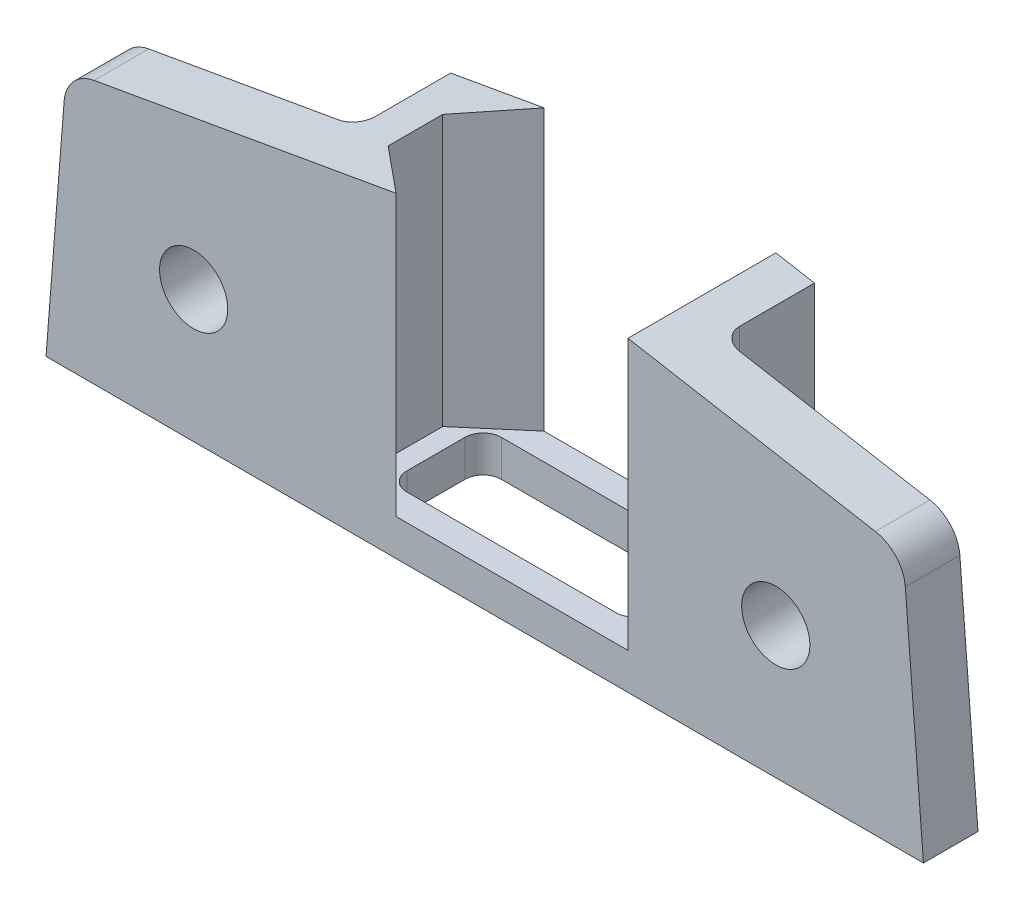
from build123d import *

# Parameters (mm, degrees)
SKETCH1_R           = 1.5
BOSS_EXTRUDE1_DEPTH = 8.13
CUT_EXTRUDE1_DEPTH  = 16.25
CUT_EXTRUDE2_REACH  = 32.018
SKETCH3_W           = 13.5
SKETCH3_H           = 5.2
SKETCH4_R           = 1.5
CUT_EXTRUDE3_DEPTH  = 5.13
CUT_EXTRUDE4_REACH  = 96.714
SKETCH5_W           = 48.91393719
SKETCH5_H           = 4.31806182
FILLET1_R           = 1
CUT_EXTRUDE6_REACH  = 96.417
SKETCH8_R           = 1.875


with BuildPart() as part:
    # Sketch1 → Boss-Extrude1 (new body)
    with BuildSketch(Plane.XY):
        with BuildLine():
            Line((-24.456968595, 69.43193818), (24.456968595, 69.43193818))
            Line((24.456968595, 69.43193818), (23.121499045, 86.400687699))
            ThreePointArc((23.121499045, 86.400687699), (22.608100633, 87.588503122), (21.474960733, 88.213385013))
            Line((21.474960733, 88.213385013), (0, 92))
            Line((0, 92), (-21.474960733, 88.213385013))
            ThreePointArc((-21.474960733, 88.213385013), (-22.608100633, 87.588503122), (-23.121499045, 86.400687699))
            Line((-23.121499045, 86.400687699), (-24.456968595, 69.43193818))
        make_face()
        with Locations((-16, 81)):
            Circle(SKETCH1_R, mode=Mode.SUBTRACT)
        with Locations((16, 81)):
            Circle(SKETCH1_R, mode=Mode.SUBTRACT)
    extrude(amount=BOSS_EXTRUDE1_DEPTH)

    # Sketch2 → Cut-Extrude1 (cut)
    with BuildSketch(Plane(origin=(0, 92, 0), x_dir=(1, 0, 0), z_dir=(0, 1, 0))):
        Polygon((7.875, 0), (-4.875, 0), (-7.875, -2.565), (-7.875, -5.565), (-4.875, -8.13), (7.875, -8.13), align=None)
    extrude(amount=-CUT_EXTRUDE1_DEPTH, mode=Mode.SUBTRACT)

    # Sketch3 → Cut-Extrude2 (cut, up to next)
    with BuildSketch(Plane(origin=(0, 75.75, 0), x_dir=(1, 0, 0), z_dir=(0, 1, 0)), mode=Mode.PRIVATE) as cut_extrude2_sk1:
        with Locations((0, -4.065)):
            Rectangle(SKETCH3_W, SKETCH3_H)
    cut_extrude2_tool1 = extrude(cut_extrude2_sk1.sketch, amount=-CUT_EXTRUDE2_REACH, mode=Mode.PRIVATE) & part.part
    add(cut_extrude2_tool1.solids().sort_by_distance((0, 75.75, 4.065))[0], mode=Mode.SUBTRACT)

    # Sketch4 → Cut-Extrude3 (cut)
    # profile 1 of 2: a face of its own
    with BuildSketch(Plane(origin=(0, 0, 0), x_dir=(-1, 0, 0), z_dir=(0, 0, -1))):
        with BuildLine():
            Line((-10, 69.43193818), (-10, 90.236730193))
            Line((-10, 90.236730193), (-21.474960733, 88.213385013))
            ThreePointArc((-21.474960733, 88.213385013), (-22.608100633, 87.588503122), (-23.121499045, 86.400687699))
            Line((-23.121499045, 86.400687699), (-24.456968595, 69.43193818))
            Line((-24.456968595, 69.43193818), (-10, 69.43193818))
        make_face()
        with Locations(Location((-16, 81, 0), (0, 0, 180))):
            Circle(SKETCH4_R, mode=Mode.SUBTRACT)
    # profile 2 of 2: a face of its own
    with BuildSketch(Plane(origin=(0, 0, 0), x_dir=(-1, 0, 0), z_dir=(0, 0, -1))):
        with BuildLine():
            Line((10, 90.236730193), (10, 69.43193818))
            Line((10, 69.43193818), (24.456968595, 69.43193818))
            Line((24.456968595, 69.43193818), (23.121499045, 86.400687699))
            ThreePointArc((23.121499045, 86.400687699), (22.608100633, 87.588503122), (21.474960733, 88.213385013))
            Line((21.474960733, 88.213385013), (10, 90.236730193))
        make_face()
        with Locations(Location((16, 81, 0), (0, 0, 180))):
            Circle(SKETCH4_R, mode=Mode.SUBTRACT)
    extrude(amount=-CUT_EXTRUDE3_DEPTH, mode=Mode.SUBTRACT)

    # Sketch5 → Cut-Extrude4 (cut, up to next)
    with BuildSketch(Plane(origin=(0, 0, 0), x_dir=(-1, 0, 0), z_dir=(0, 0, -1)), mode=Mode.PRIVATE) as cut_extrude4_sk1:
        with Locations((0, 71.59096909)):
            Rectangle(SKETCH5_W, SKETCH5_H)
    cut_extrude4_tool1 = extrude(cut_extrude4_sk1.sketch, amount=-CUT_EXTRUDE4_REACH, mode=Mode.PRIVATE) & part.part
    add(cut_extrude4_tool1.solids().sort_by_distance((0, 71.590969, 0))[0], mode=Mode.SUBTRACT)

    # Fillet1
    # the kernel refuses this fillet: 1 mm, written as the material it adds along each edge
    with BuildSketch(Plane(origin=(-10, 92.736730193, 5.13), x_dir=(-1, 0, 0), z_dir=(0, -1, 0))) as fillet1_piece_1_section:
        with BuildLine():
            CenterArc((FILLET1_R, FILLET1_R), FILLET1_R, 180, 90)
            Line((0, FILLET1_R), (0, 0))
            Line((0, 0), (FILLET1_R, 0))
        make_face()
    fillet1_piece_1 = extrude(amount=18.986730193, mode=Mode.PRIVATE)
    fillet1_piece_1 = split(fillet1_piece_1, bisect_by=Plane(origin=(-11.632189481, 89.94893115, 4.903310521), z_dir=(0.17364817766693327, -0.9848077530122076, 0)), keep=Keep.TOP, mode=Mode.PRIVATE)
    add(fillet1_piece_1)
    with BuildSketch(Plane(origin=(6.75, 75.75, 1.465), x_dir=(0, 0, 1), z_dir=(0, -1, 0)), Plane(origin=(-6.75, 75.75, 6.665), x_dir=(0, 0, -1), z_dir=(0, -1, 0)), Plane(origin=(6.75, 75.75, 6.665), x_dir=(-1, 0, 0), z_dir=(0, -1, 0))) as fillet1_piece_2:
        with BuildLine():
            CenterArc((FILLET1_R, FILLET1_R), FILLET1_R, 180, 90)
            Line((0, FILLET1_R), (0, 0))
            Line((0, 0), (FILLET1_R, 0))
        make_face()
    extrude(amount=2)
    with BuildSketch(Plane(origin=(-6.75, 75.75, 1.465), x_dir=(0, 0, 1), z_dir=(0, -1, 0))) as fillet1_piece_3:
        with BuildLine():
            CenterArc((FILLET1_R, -FILLET1_R), FILLET1_R, 90, 90)
            Line((0, -FILLET1_R), (0, 0))
            Line((0, 0), (FILLET1_R, 0))
        make_face()
    extrude(amount=2)
    with BuildSketch(Plane(origin=(10, 73.75, 5.13), x_dir=(0, 0, -1), z_dir=(0, 1, 0))) as fillet1_piece_4_section:
        with BuildLine():
            CenterArc((FILLET1_R, -FILLET1_R), FILLET1_R, 90, 90)
            Line((0, -FILLET1_R), (0, 0))
            Line((0, 0), (FILLET1_R, 0))
        make_face()
    fillet1_piece_4 = extrude(amount=18.986730193, mode=Mode.PRIVATE)
    fillet1_piece_4 = split(fillet1_piece_4, bisect_by=Plane(origin=(11.632189481, 89.94893115, 4.903310521), z_dir=(-0.17364817766693252, -0.9848077530122077, 0)), keep=Keep.TOP, mode=Mode.PRIVATE)
    add(fillet1_piece_4)

    # Sketch8 → Cut-Extrude6 (cut, up to next)
    with BuildSketch(Plane(origin=(0, 0, 5.13), x_dir=(-1, 0, 0), z_dir=(0, 0, -1)), mode=Mode.PRIVATE) as cut_extrude6_sk1:
        with Locations((16, 81)):
            Circle(SKETCH8_R)
    cut_extrude6_tool1 = extrude(cut_extrude6_sk1.sketch, amount=-CUT_EXTRUDE6_REACH, mode=Mode.PRIVATE) & part.part
    # Sketch8 → Cut-Extrude6 (cut, up to next)
    with BuildSketch(Plane(origin=(0, 0, 5.13), x_dir=(-1, 0, 0), z_dir=(0, 0, -1)), mode=Mode.PRIVATE) as cut_extrude6_sk2:
        with Locations((-16, 81)):
            Circle(SKETCH8_R)
    cut_extrude6_tool2 = extrude(cut_extrude6_sk2.sketch, amount=-CUT_EXTRUDE6_REACH, mode=Mode.PRIVATE) & part.part
    add(cut_extrude6_tool1.solids().sort_by_distance((-16, 81, 5.13))[0], mode=Mode.SUBTRACT)
    add(cut_extrude6_tool2.solids().sort_by_distance((16, 81, 5.13))[0], mode=Mode.SUBTRACT)


solid = part.part
